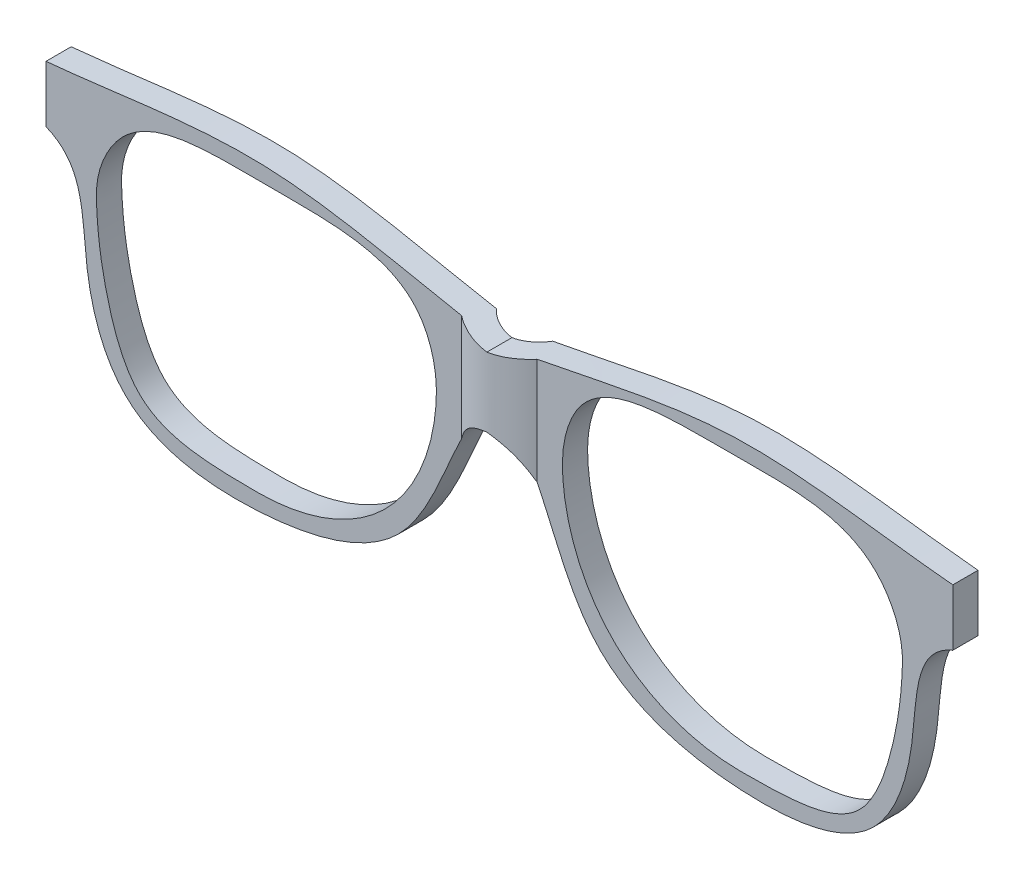
from build123d import *

# Parameters (mm, degrees)
BOSS_EXTRUDE2_START = -10
BOSS_EXTRUDE2_DEPTH = 58
CUT_EXTRUDE1_DEPTH  = 48
CUT_EXTRUDE3_DEPTH  = 48
SKETCH7_W           = 3
SKETCH7_H           = 3
BOSS_EXTRUDE4_DEPTH = 2
FILLET1_R           = 0.5
SKETCH8_R           = 0.5
CUT_EXTRUDE4_DEPTH  = 3


# Read off the part's stored shape, not the designer's step: Mirror3
with BuildPart() as part:
    # Sketch2 → Boss-Extrude2 (new body)
    with BuildSketch(Plane(origin=(0, 0, 0), x_dir=(1, 0, 0), z_dir=(0, 1, 0)).offset(BOSS_EXTRUDE2_START)):
        with BuildLine():
            Line((6, 2), (72, 2))
            Line((72, 2), (72, 6))
            Line((72, 6), (4.472135955, 6))
            ThreePointArc((4.472135955, 6), (2.449489743, 4.522774425), (0, 4))
            Line((0, 4), (0, 0))
            ThreePointArc((0, 0), (3.16227766, 0.513167019), (6, 2))
        make_face()
    boss_extrude2 = extrude(amount=BOSS_EXTRUDE2_DEPTH)

    # Sketch4 → Cut-Extrude1 (cut)
    with BuildSketch(Plane.XY):
        with BuildLine():
            Line((75.181024804, -21.70251563), (72, 33.5))
            add(Edge.make_bspline(
                [(72, 33.5), (65.733895707, 30.986863851), (66.897988293, 17.744017336), (60.184304866, -1.408989634), (37.041632207, -3.974195098), (14.79772784, 1.928607021), (8.326301166, 19.085602566), (3.971434767, 27.945368893), (0, 28.5)],
                knots=[0, 0, 0, 0, 0.166940083, 0.318250601, 0.518054161, 0.734725038, 0.904637492, 1, 1, 1, 1], degree=3))
            Line((0, 28.5), (-1.793667206, -21.70251563))
            Line((-1.793667206, -21.70251563), (75.181024804, -21.70251563))
        make_face()
        with BuildLine():
            Line((0, 39.5), (0, 66.878987003))
            Line((0, 66.878987003), (72, 65.421074967))
            Line((72, 65.421074967), (72, 42.5))
            add(Edge.make_bspline(
                [(0, 39.5), (12.28727979, 41.355933166), (36.181117827, 48.373206471), (60.430055597, 43.550313065), (72, 42.5)],
                knots=[0, 0, 0, 0, 0.516941008, 1, 1, 1, 1], degree=3))
        make_face()
    cut_extrude1 = extrude(amount=-CUT_EXTRUDE1_DEPTH, mode=Mode.SUBTRACT)

    # Sketch3 → Cut-Extrude3 (cut)
    with BuildSketch(Plane.XY):
        with BuildLine():
            add(Edge.make_bspline(
                [(39, 43), (47.455166281, 43.034379293), (58.672301943, 43.086153016), (64.123941507, 31.567507143), (63.869059347, 23.047129354), (62.634483109, 14.698309693), (57.380279449, 0.640489267), (45.579929681, 0.061052081), (30.647288037, -0.10197224), (16.378399599, 5.905052669), (10.27410697, 19.960221638), (9.855802774, 30.870699355), (13.540960725, 43.329764048), (27.180471598, 42.952614894), (37.93578121, 42.995672813), (39, 43)],
                knots=[0, 0, 0, 0, 0.137810111, 0.19969144, 0.215595383, 0.296849548, 0.368224057, 0.474166526, 0.500284011, 0.629398899, 0.753161556, 0.772876045, 0.82654379, 0.982654379, 1, 1, 1, 1], degree=3))
        make_face()
    cut_extrude3 = extrude(amount=-CUT_EXTRUDE3_DEPTH, mode=Mode.SUBTRACT)

    # Mirror2: Boss-Extrude2, Cut-Extrude1, Cut-Extrude3 across plane
    add(boss_extrude2.mirror(Plane(origin=(0, 0, 0), x_dir=(0, 0, 1), z_dir=(1, 0, 0))))
    add(cut_extrude1.mirror(Plane(origin=(0, 0, 0), x_dir=(0, 0, 1), z_dir=(1, 0, 0))), mode=Mode.SUBTRACT)
    add(cut_extrude3.mirror(Plane(origin=(0, 0, 0), x_dir=(0, 0, 1), z_dir=(1, 0, 0))), mode=Mode.SUBTRACT)

    # Sketch7 → Boss-Extrude4 (add)
    with BuildSketch(Plane(origin=(0, 0, -6), x_dir=(-1, 0, 0), z_dir=(0, 0, -1))):
        with Locations((-68.5, 38)):
            Rectangle(SKETCH7_W, SKETCH7_H)
    extrude(amount=BOSS_EXTRUDE4_DEPTH)

    # Fillet1
    fillet1_edges = [part.edges().sort_by_distance(p)[0] for p in [
        (70, 38, -8),
        (68.5, 36.5, -8),
        (67, 38, -8),
        (68.5, 39.5, -8),
    ]]
    fillet(fillet1_edges, radius=FILLET1_R)

    # Sketch8 → Cut-Extrude4 (cut)
    with BuildSketch(Plane(origin=(0, 39.5, 0), x_dir=(1, 0, 0), z_dir=(0, 1, 0))):
        with Locations(Location((68.5, 7, 0), (0, 0, 90))):
            Circle(SKETCH8_R)
    extrude(amount=-CUT_EXTRUDE4_DEPTH, mode=Mode.SUBTRACT)

    # Mirror3: part across plane


with BuildPart() as part_1:
    add(part.part)
    add(part.part.mirror(Plane(origin=(0, 0, 0), x_dir=(0, 0, 1), z_dir=(1, 0, 0))))


solid = part_1.part
